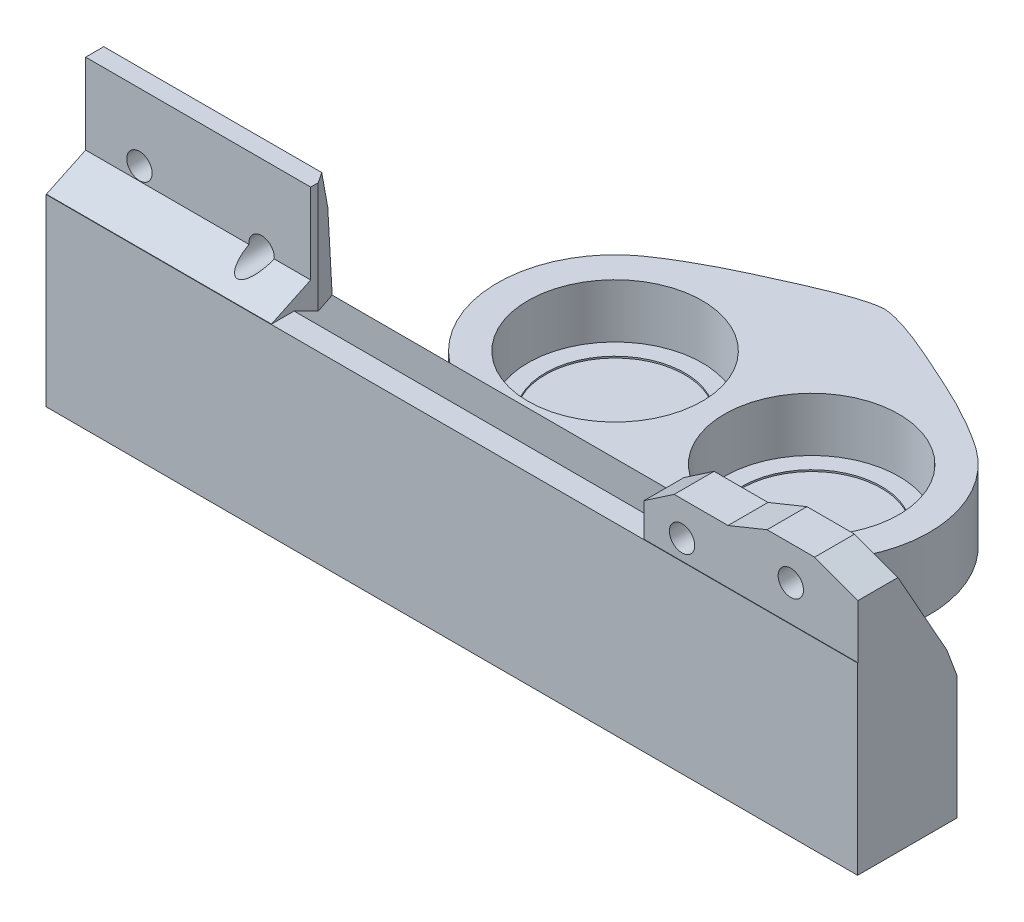
from build123d import *
from build123d.topology import SkipClean

# Parameters (mm, degrees)
SKETCH1_W                = 100
SKETCH1_H                = 50
BOSS_EXTRUDE1_DEPTH      = 9
CUT_EXTRUDE2_DEPTH       = 10
SKETCH6_W                = 120
SKETCH6_H                = 9
BOSS_EXTRUDE2_DEPTH      = 10
SKETCH7_R                = 11.000000016
SKETCH7_R_2              = 10.999999993
CUT_EXTRUDE3_DEPTH       = 6.8
SKETCH8_R                = 8.8
CUT_EXTRUDE4_DEPTH       = 0.2
BOSS_EXTRUDE3_DEPTH      = 21
CUT_EXTRUDE6_DEPTH       = 13
CUT_EXTRUDE7_DEPTH       = 13
LPATTERN1_COUNT          = 2
LPATTERN1_PITCH          = 17
CUT_EXTRUDE8_DEPTH       = 123
SKETCH15_W               = 10
SKETCH15_H               = 7.899400514
CUT_EXTRUDE9_DEPTH       = 5
CUT_EXTRUDE10_DEPTH      = 19
CUT_EXTRUDE10_DEPTH_BACK = 11
MOVE_FACE1_BY            = 5
SKETCH18_W               = 8.8
SKETCH18_H               = 9.911873884
SKETCH18_H_2             = 10
CUT_EXTRUDE11_DEPTH      = 11
SKETCH19_R               = 2.17746248
CUT_EXTRUDE12_DEPTH      = 9
BOSS_EXTRUDE6_DEPTH      = 26.7
CUT_EXTRUDE13_DEPTH      = 31.7
BOSS_EXTRUDE7_REACH      = 106.617
BOSS_EXTRUDE8_REACH      = 115.546
BOSS_EXTRUDE9_REACH      = 115.546
BOSS_EXTRUDE10_DEPTH     = 14.7
BOSS_EXTRUDE11_DEPTH     = 14.7
CUT_EXTRUDE14_DEPTH      = 85.235044064
CUT_EXTRUDE14_DEPTH_BACK = 85.235044064
SKETCH29_R               = 1.599999991
SKETCH29_R_2             = 1.6
MOVE_START               = 27.410060373
MOVE_FACE2_DEPTH         = 7
SKETCH31_W               = 16.4
SKETCH31_H               = 5.038125723
BOSS_EXTRUDE12_DEPTH     = 2
CUT_EXTRUDE16_DEPTH      = 6.05
SKETCH30_R               = 1.6
SKETCH30_R_2             = 1.599999991
CUT_EXTRUDE17_DEPTH      = 6
CUT_EXTRUDE18_DEPTH      = 6
BOSS_EXTRUDE14_DEPTH     = 9
CUT_EXTRUDE19_DEPTH      = 19
BOSS_EXTRUDE15_REACH     = 115.546
SKETCH39_W               = 102.4
SKETCH39_H               = 19
BOSS_EXTRUDE16_DEPTH     = 5
MOVE_START_2             = 27.202290076
MOVE_FACE3_DEPTH         = 1.5
MOVE_START_3             = -57.989939627
MOVE_FACE4_DEPTH         = 102.4
CUT_EXTRUDE21_START      = -5
SKETCH40_R               = 1.6
CUT_EXTRUDE21_DEPTH      = 5
BOSS_EXTRUDE17_DEPTH     = 3
LPATTERN2_COUNT          = 2
LPATTERN2_PITCH          = 15


with BuildPart() as part:
    # Sketch1 → Boss-Extrude1 (new body)
    with BuildSketch(Plane(origin=(0, 0, 0), x_dir=(1, 0, 0), z_dir=(0, 1, 0))):
        with Locations((-4.071246819, 6.297709924)):
            Rectangle(SKETCH1_W, SKETCH1_H)
    extrude(amount=BOSS_EXTRUDE1_DEPTH)

    # Sketch3 → Cut-Extrude2 (cut)
    with BuildSketch(Plane(origin=(0, 9, 0), x_dir=(1, 0, 0), z_dir=(0, 1, 0))):
        with BuildLine():
            Line((13.562694185, -13.254917088), (19.796593595, -18.702290076))
            Line((19.796593595, -18.702290076), (45.928753181, -18.702290076))
            Line((45.928753181, -18.702290076), (45.928753181, 31.297709924))
            Line((45.928753181, 31.297709924), (-6.789939627, 31.297709924))
            Line((-6.789939627, 31.297709924), (-6.789939627, 20.878144865))
            add(Edge.make_bspline(
                [(-6.789939627, 20.878144865), (-4.152217911, 20.754884744), (2.59018392, 17.585299423), (7.958165168, 15.205908702), (11.899983065, 13.0642773), (14.302849715, 11.349730645)],
                knots=[0, 0, 0, 0, 0.385334853, 0.485334853, 1, 1, 1, 1], degree=3))
            ThreePointArc((14.302849715, 11.349730645), (20.46404385, -1.149066549), (13.562694185, -13.254917088))
        make_face()
    cut_extrude2 = extrude(amount=-CUT_EXTRUDE2_DEPTH, mode=Mode.SUBTRACT)

    # Mirror1: Cut-Extrude2 across plane
    add(cut_extrude2.mirror(Plane(origin=(-6.789939627, -1, -31.297709924), x_dir=(0, 0, 1), z_dir=(-1, 0, 0))), mode=Mode.SUBTRACT)

    # Sketch6 → Boss-Extrude2 (add)
    with BuildSketch(Plane.XY.offset(18.702290076)):
        with Locations((-6.789939627, 4.5)):
            Rectangle(SKETCH6_W, SKETCH6_H)
    extrude(amount=BOSS_EXTRUDE2_DEPTH)

    # Sketch7 → Cut-Extrude3 (cut)
    with BuildSketch(Plane(origin=(0, 9, 0), x_dir=(1, 0, 0), z_dir=(0, 1, 0))):
        with Locations(Location((5.612060368, -0.702290075, 0), (0, 0, 270))):
            Circle(SKETCH7_R)
        with Locations(Location((-19.191939622, -0.702289879, 0), (0, 0, 270))):
            Circle(SKETCH7_R_2)
    extrude(amount=-CUT_EXTRUDE3_DEPTH, mode=Mode.SUBTRACT)

    # Sketch8 → Cut-Extrude4 (cut)
    with BuildSketch(Plane(origin=(0, 2.2, 0), x_dir=(1, 0, 0), z_dir=(0, 1, 0))):
        with Locations(Location((5.612060368, -0.702290075, 0), (0, 0, 270))):
            Circle(SKETCH8_R)
        with Locations(Location((-19.191939622, -0.702289879, 0), (0, 0, 270))):
            Circle(SKETCH8_R)
    extrude(amount=-CUT_EXTRUDE4_DEPTH, mode=Mode.SUBTRACT)

    # Sketch9 → Boss-Extrude3 (add)
    with BuildSketch(Plane(origin=(0, 9, 0), x_dir=(1, 0, 0), z_dir=(0, 1, 0))):
        Polygon((27.410060373, -18.702290076), (17.410060373, -18.702290076), (17.410060373, -28.702290076), (17.410060373, -33.652289683), (27.410060373, -33.652289683), (27.410060373, -28.702290076), align=None)
    boss_extrude3 = extrude(amount=BOSS_EXTRUDE3_DEPTH)

    # Sketch10 → Cut-Extrude6 (cut)
    with BuildSketch(Plane(origin=(27.410060373, 0, 0), x_dir=(0, 0, -1), z_dir=(1, 0, 0))):
        Polygon((-28.702290076, 9), (-33.652289683, 22.202285695), (-33.652289683, 9), align=None)
    cut_extrude6 = extrude(amount=-CUT_EXTRUDE6_DEPTH, mode=Mode.SUBTRACT)

    # Sketch11 → Cut-Extrude7 (cut)
    with BuildSketch(Plane(origin=(27.410060373, 0, 0), x_dir=(0, 0, -1), z_dir=(1, 0, 0))):
        Polygon((-18.702290076, 9), (-18.702290076, 22.202285694), (-18.702290076, 30), (-23.61416396, 30), (-23.61416396, 22.100599486), align=None)
    cut_extrude7 = extrude(amount=-CUT_EXTRUDE7_DEPTH, mode=Mode.SUBTRACT)

    # LPattern1: Boss-Extrude3, Cut-Extrude6, Cut-Extrude7 ×2
    with Locations(*[(i * LPATTERN1_PITCH, 0, 0) for i in range(1, LPATTERN1_COUNT)]):
        add(boss_extrude3)
        add(cut_extrude6, mode=Mode.SUBTRACT)
        add(cut_extrude7, mode=Mode.SUBTRACT)

    # Sketch13 → Cut-Extrude8 (cut)
    with BuildSketch(Plane.ZY.offset(66.789939627)):
        Polygon((28.702290076, 9), (27.202290076, 0), (28.702290076, 0), align=None)
    extrude(amount=-CUT_EXTRUDE8_DEPTH, mode=Mode.SUBTRACT)

    # Sketch15 → Cut-Extrude9 (cut)
    with BuildSketch(Plane(origin=(0, 0, 23.61416396), x_dir=(-1, 0, 0), z_dir=(0, 0, -1))):
        with Locations((-22.410060373, 26.050299743)):
            Rectangle(SKETCH15_W, SKETCH15_H)
    extrude(amount=-CUT_EXTRUDE9_DEPTH, mode=Mode.SUBTRACT)

    # Sketch17 → Cut-Extrude10 (cut, two sides: drawn at the far end of the back side and taken through both)
    with BuildSketch(Plane(origin=(27.410060373, 0, 0), x_dir=(0, 0, -1), z_dir=(1, 0, 0)).offset(-CUT_EXTRUDE10_DEPTH_BACK)):
        Polygon((-22.451640546, 19), (-28.61416396, 22.100599486), (-23.61416396, 22.100599486), align=None)
    extrude(amount=CUT_EXTRUDE10_DEPTH + CUT_EXTRUDE10_DEPTH_BACK, mode=Mode.SUBTRACT)

    # Move Face1: a face moved inward by 5.0
    extrude(part.faces().sort_by_distance((39.410060373, 26.050299743, 23.61416396))[0], amount=MOVE_FACE1_BY, dir=(0, 0, 1), mode=Mode.SUBTRACT)

    # Sketch18 → Cut-Extrude11 (cut)
    with BuildSketch(Plane(origin=(0, 9, 0), x_dir=(1, 0, 0), z_dir=(0, 1, 0))):
        with Locations((48.810060373, -23.658227018)):
            Rectangle(SKETCH18_W, SKETCH18_H)
        with Locations((-62.389939627, -23.702290076)):
            Rectangle(SKETCH18_W, SKETCH18_H_2)
    extrude(amount=-CUT_EXTRUDE11_DEPTH, mode=Mode.SUBTRACT)

    # Sketch19 → Cut-Extrude12 (cut)
    with BuildSketch(Plane(origin=(44.410060373, 0, 0), x_dir=(0, 0, -1), z_dir=(1, 0, 0))):
        with Locations((-27.846220708, 9.974076114)):
            Circle(SKETCH19_R)
    extrude(amount=CUT_EXTRUDE12_DEPTH, mode=Mode.SUBTRACT)

    # Sketch20 → Boss-Extrude6 (add)
    with BuildSketch(Plane(origin=(0, 9, 0), x_dir=(1, 0, 0), z_dir=(0, 1, 0))):
        Polygon((-57.989939627, -24.127818916), (-57.989939627, -28.702290076), (-29.595939593, -28.702290076), (-29.595939593, -27.749073121), (-32.01694624, -24.127818916), (-33.376472849, -24.127818916), align=None)
    extrude(amount=BOSS_EXTRUDE6_DEPTH)

    # Sketch21 → Cut-Extrude13 (cut)
    with BuildSketch(Plane.ZY.offset(57.989939627)):
        Polygon((26.415054496, 35.7), (24.127818916, 30), (24.127818916, 35.7), align=None)
    extrude(amount=-CUT_EXTRUDE13_DEPTH, mode=Mode.SUBTRACT)

    # Boss-Extrude7: up to this face of the body (flat: up to its plane)
    boss_extrude7_end = Plane(part.part.faces().sort_by_distance((-57.989939627, 14.553310719, 25.176691805))[0])
    # Sketch14 → Boss-Extrude7 (add, up to the picked face)
    with BuildSketch(Plane.ZY.offset(-34.410060373), mode=Mode.PRIVATE) as boss_extrude7_sk1:
        Polygon((18.702290076, 9), (22.451640546, 19), (28.702290076, 19), (28.702290076, 9), align=None)
    boss_extrude7_tool1 = split(extrude(boss_extrude7_sk1.sketch, amount=BOSS_EXTRUDE7_REACH, mode=Mode.PRIVATE), bisect_by=boss_extrude7_end, keep=Keep.BOTH, mode=Mode.PRIVATE)
    add(boss_extrude7_tool1.solids().sort_by(Axis((34.41006, 13.615467, 24.56754), (-1, 0, 0)))[0])

    # Boss-Extrude8: up to this plane
    boss_extrude8_end = Plane(origin=(-32.01694624, 35.7, 24.127818916), z_dir=(-0.8313251545497, 0, 0.5557863685022487))
    # Sketch23 → Boss-Extrude8 (add, up to the surface)
    with BuildSketch(Plane.ZY.offset(57.989939627), mode=Mode.PRIVATE) as boss_extrude8_sk1:
        Polygon((24.127818916, 30), (22.451640546, 19), (24.127818916, 19), align=None)
    boss_extrude8_tool1 = split(extrude(boss_extrude8_sk1.sketch, amount=-BOSS_EXTRUDE8_REACH, mode=Mode.PRIVATE), bisect_by=boss_extrude8_end, keep=Keep.BOTH, mode=Mode.PRIVATE)
    add(boss_extrude8_tool1.solids().sort_by_distance((-57.98994, 22.666667, 23.569093))[0])

    # Boss-Extrude9: up to this face of the body (flat: up to its plane)
    boss_extrude9_end = Plane(part.part.faces().sort_by_distance((17.410060373, 22.058034461, 30.278583338))[0])
    # Sketch24 → Boss-Extrude9 (add, up to the picked face)
    with BuildSketch(Plane(origin=(44.410060373, 0, 0), x_dir=(0, 0, -1), z_dir=(1, 0, 0)), mode=Mode.PRIVATE) as boss_extrude9_sk1:
        Polygon((-27.202290076, 0), (-33.652289683, 22.202285695), (-28.702290076, 9), align=None)
    boss_extrude9_tool1 = split(extrude(boss_extrude9_sk1.sketch, amount=-BOSS_EXTRUDE9_REACH, mode=Mode.PRIVATE), bisect_by=boss_extrude9_end, keep=Keep.BOTH, mode=Mode.PRIVATE)
    add(boss_extrude9_tool1.solids().sort_by(Axis((44.41006, 10.400762, 29.85229), (-1, 0, 0)))[0])

    # Sketch25 → Boss-Extrude10 (add)
    with BuildSketch(Plane(origin=(27.410060373, 0, 0), x_dir=(0, 0, -1), z_dir=(1, 0, 0))):
        Polygon((-28.702290076, 19), (-33.652289683, 22.202285695), (-28.702290076, 9), align=None)
    extrude(amount=BOSS_EXTRUDE10_DEPTH)

    # Sketch26 → Boss-Extrude11 (add)
    with BuildSketch(Plane(origin=(27.410060373, 0, 0), x_dir=(0, 0, -1), z_dir=(1, 0, 0))):
        Polygon((-28.702290076, 19), (-28.652289683, 22.202285695), (-33.652289683, 22.202285695), align=None)
    extrude(amount=BOSS_EXTRUDE11_DEPTH)

    # Sketch29 → Cut-Extrude14 (cut, two sides: drawn at the far end of the back side and taken through both)
    with BuildSketch(Plane.XY.offset(28.702290076).offset(-CUT_EXTRUDE14_DEPTH_BACK)):
        with Locations(Location((-51.195939153, 27.20228574, 0), (0, 0, 90))):
            Circle(SKETCH29_R)
        with Locations(Location((-35.789940507, 25.702285731, 0), (0, 0, 90))):
            Circle(SKETCH29_R_2)
    extrude(amount=CUT_EXTRUDE14_DEPTH + CUT_EXTRUDE14_DEPTH_BACK, mode=Mode.SUBTRACT)

    # Move Face2: read off the stored shape, not the designer's step
    # Move Face2 outline → Move Face2 (add)
    with BuildSketch(Plane.YZ.offset(MOVE_START)):
        Polygon((30, 33.652289683), (22.202285695, 33.652289683), (22.202285695, 28.652289683), (19, 28.702290076), (19, 22.451640546), (22.100599486, 28.61416396), (30, 28.61416396), align=None)
    extrude(amount=MOVE_FACE2_DEPTH)

    # Sketch31 → Boss-Extrude12 (add)
    with BuildSketch(Plane(origin=(0, 30, 0), x_dir=(1, 0, 0), z_dir=(0, 1, 0))):
        with Locations((36.210060373, -31.133226822)):
            Rectangle(SKETCH31_W, SKETCH31_H)
    extrude(amount=BOSS_EXTRUDE12_DEPTH)

    # Sketch32 → Cut-Extrude16 (cut)
    with BuildSketch(Plane(origin=(0, 0, 28.61416396), x_dir=(-1, 0, 0), z_dir=(0, 0, -1))):
        Polygon((-44.410060373, 30), (-44.410060373, 32), (-38.931179059, 32), align=None)
        Polygon((-28.010060373, 30), (-32.931179059, 32), (-28.010060373, 32), align=None)
    extrude(amount=-CUT_EXTRUDE16_DEPTH, mode=Mode.SUBTRACT)

    # Sketch30 → Cut-Extrude17 (cut)
    with BuildSketch(Plane.XY.offset(33.652289683)):
        with Locations((35.931179059, 27.692596899)):
            Circle(SKETCH30_R)
        with Locations((22.210059502, 25.702285697)):
            Circle(SKETCH30_R_2)
    extrude(amount=-CUT_EXTRUDE17_DEPTH, mode=Mode.SUBTRACT)

    # Sketch33 → Cut-Extrude18 (cut)
    with BuildSketch(Plane(origin=(0, 0, 28.61416396), x_dir=(-1, 0, 0), z_dir=(0, 0, -1))):
        Polygon((-17.410060373, 27.419135074), (-21.213644003, 30), (-17.410060373, 30), align=None)
    extrude(amount=-CUT_EXTRUDE18_DEPTH, mode=Mode.SUBTRACT)

    # Sketch35 → Boss-Extrude14 (add)
    with BuildSketch(Plane.XZ):
        Polygon((34.074428928, 18.72995129), (14.543666487, 14.11212085), (18.502510714, 19.900348682), align=None)
    boss_extrude14 = extrude(amount=-BOSS_EXTRUDE14_DEPTH)

    # Mirror2: Boss-Extrude14 across plane
    add(boss_extrude14.mirror(Plane.ZY.offset(6.789939627)))

    # Sketch36 → Cut-Extrude19 (cut)
    with BuildSketch(Plane.XZ):
        Polygon((-45.035004515, 18.110646219), (-63.303865733, 22.430112499), (-62.152837271, 15.954516445), align=None)
    cut_extrude19 = extrude(amount=-CUT_EXTRUDE19_DEPTH, mode=Mode.SUBTRACT)

    # Mirror3: Cut-Extrude19 across plane
    add(cut_extrude19.mirror(Plane.ZY.offset(6.789939627)), mode=Mode.SUBTRACT)

    # Boss-Extrude15: up to this face of the body (flat: up to its plane)
    boss_extrude15_end = Plane(part.part.faces().sort_by_distance((-29.595939593, 27.35, 28.225681599))[0])
    # Sketch38 → Boss-Extrude15 (add, up to the picked face)
    with BuildSketch(Plane.ZY.offset(57.989939627), mode=Mode.PRIVATE) as boss_extrude15_sk1:
        Polygon((33.652289683, 23.202285744), (28.702290076, 25.545459561), (28.702290076, 9), align=None)
    boss_extrude15_tool1 = split(extrude(boss_extrude15_sk1.sketch, amount=-BOSS_EXTRUDE15_REACH, mode=Mode.PRIVATE), bisect_by=boss_extrude15_end, keep=Keep.BOTH, mode=Mode.PRIVATE)
    add(boss_extrude15_tool1.solids().sort_by(Axis((-57.98994, 19.249248, 30.35229), (1, 0, 0)))[0])

    # Sketch39 → Boss-Extrude16 (add)
    with BuildSketch(Plane.XY.offset(28.702290076)):
        with Locations((-6.789939627, 9.5)):
            Rectangle(SKETCH39_W, SKETCH39_H)
    extrude(amount=BOSS_EXTRUDE16_DEPTH)

    # Move Face3: read off the stored shape, not the designer's step
    # Move Face3 outline → Move Face3 (add)
    with BuildSketch(Plane.XY.offset(MOVE_START_2)):
        Polygon((44.410060373, 5.163322569), (17.410060373, 5.163322569), (17.410060373, 9), (-57.989939627, 9), (-57.989939627, 0), (44.410060373, 0), align=None)
    extrude(amount=MOVE_FACE3_DEPTH)

    # Move Face4: read off the stored shape, not the designer's step
    # Move Face4 outline → Move Face4 (add)
    with BuildSketch(Plane.YZ.offset(MOVE_START_3)):
        Polygon((23.2, 33.702290076), (19, 33.702290076), (19, 22.451640546), (23.2, 30.799251533), align=None)
    extrude(amount=MOVE_FACE4_DEPTH)

    # Sketch40 → Cut-Extrude21 (cut)
    with SkipClean():  # the faces are left unmerged after this step: merging them gives an invalid solid
        with BuildSketch(Plane(origin=(0, 0, 28.702290076), x_dir=(-1, 0, 0), z_dir=(0, 0, -1)).offset(CUT_EXTRUDE21_START)):
            with Locations(Location((35.789940507, 25.702285731, 0), (0, 0, 185.624954879))):
                Circle(SKETCH40_R)
        extrude(amount=CUT_EXTRUDE21_DEPTH, mode=Mode.SUBTRACT)

    # Sketch41 → Boss-Extrude17 (add)
    with SkipClean():  # the faces are left unmerged after this step: merging them gives an invalid solid
        with BuildSketch(Plane(origin=(44.410060373, 0, 0), x_dir=(0, 0, -1), z_dir=(1, 0, 0))):
            Polygon((-28.61416396, 30), (-22.451640546, 19), (-28.61416396, 22.100599486), align=None)
        boss_extrude17 = extrude(amount=-BOSS_EXTRUDE17_DEPTH)

    # LPattern2: Boss-Extrude17 ×2
    with SkipClean():  # the faces are left unmerged after this step: merging them gives an invalid solid
        with Locations(*[(-i * LPATTERN2_PITCH, 0, 0) for i in range(1, LPATTERN2_COUNT)]):
            add(boss_extrude17)


solid = part.part
